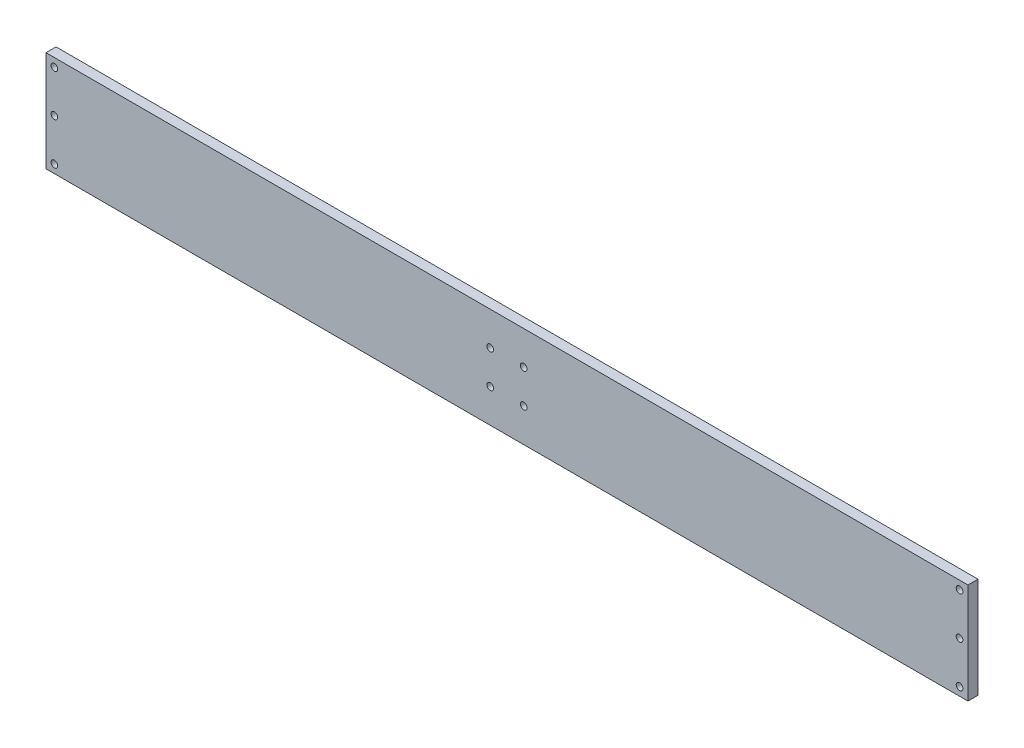
from build123d import *

# Parameters (mm, degrees)
SCHIZZO1_W                   = 550
SCHIZZO1_H                   = 60
SCHIZZO1_R                   = 2
ESTRUSIONE_ESTRUSIONE1_DEPTH = 6
SCHIZZO2_R                   = 2
TAGLIO_ESTRUSIONE1_DEPTH     = 554.295581041


with BuildPart() as part:
    # Schizzo1 → Estrusione-Estrusione1 (new body)
    with BuildSketch(Plane.XY):
        with Locations((275, 30)):
            Rectangle(SCHIZZO1_W, SCHIZZO1_H)
        with Locations((5, 30)):
            Circle(SCHIZZO1_R, mode=Mode.SUBTRACT)
        with Locations((5, 55)):
            Circle(SCHIZZO1_R, mode=Mode.SUBTRACT)
        with Locations((5, 5)):
            Circle(SCHIZZO1_R, mode=Mode.SUBTRACT)
        with Locations((545, 5)):
            Circle(SCHIZZO1_R, mode=Mode.SUBTRACT)
        with Locations((545, 55)):
            Circle(SCHIZZO1_R, mode=Mode.SUBTRACT)
        with Locations((545, 30)):
            Circle(SCHIZZO1_R, mode=Mode.SUBTRACT)
    extrude(amount=-ESTRUSIONE_ESTRUSIONE1_DEPTH)

    # Schizzo2 → Taglio-Estrusione1 (cut, through all)
    with BuildSketch(Plane.XY):
        with Locations((265, 40)):
            Circle(SCHIZZO2_R)
        with Locations((285, 40)):
            Circle(SCHIZZO2_R)
        with Locations((285, 20)):
            Circle(SCHIZZO2_R)
        with Locations((265, 20)):
            Circle(SCHIZZO2_R)
    extrude(amount=-TAGLIO_ESTRUSIONE1_DEPTH, mode=Mode.SUBTRACT)


solid = part.part
